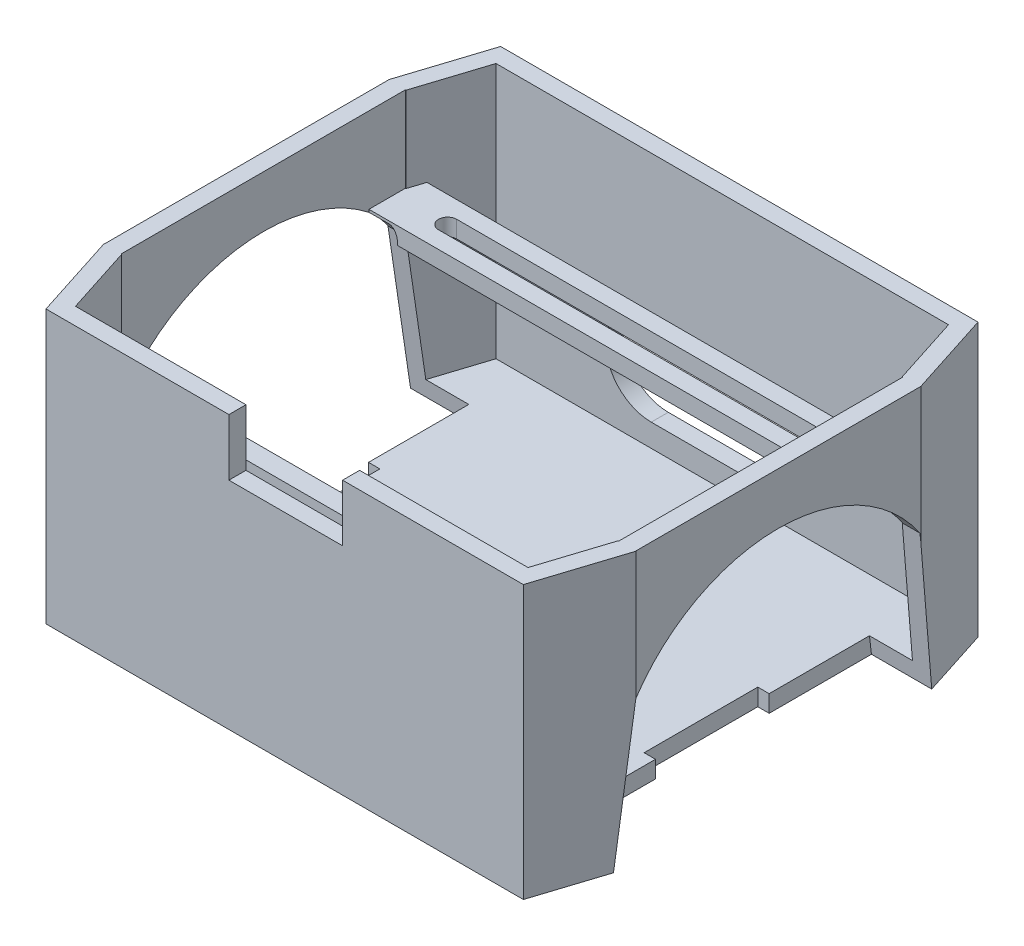
from build123d import *

# Parameters (mm, degrees)
SKETCH1_W            = 90
SKETCH1_H            = 80
BOSS_EXTRUDE1_DEPTH  = 3
SKETCH2_W            = 11.75
SKETCH2_H            = 50
CUT_EXTRUDE1_DEPTH   = 3
SKETCH3_W            = 2
SKETCH3_H            = 15
BOSS_EXTRUDE2_DEPTH  = 3
BOSS_EXTRUDE3_DEPTH  = 3
CUT_EXTRUDE2_DEPTH   = 3
BOSS_EXTRUDE4_DEPTH  = 45
BOSS_EXTRUDE5_DEPTH  = 3
CUT_EXTRUDE3_DEPTH   = 3
CUT_EXTRUDE6_START   = -93.59401
CUT_EXTRUDE6_DEPTH   = 93.644295
MIRROR4_START        = 35.25
MIRROR4_DEPTH        = 11.572147393
SKETCH17_W           = 70.5
SKETCH17_H           = 3
BOSS_EXTRUDE10_DEPTH = 3
SKETCH19_W           = 79.626439034
SKETCH19_H           = 3
BOSS_EXTRUDE11_DEPTH = 10
CUT_EXTRUDE7_DEPTH   = 10
SKETCH22_W           = 87.543724768
SKETCH22_H           = 9.2
BOSS_EXTRUDE12_DEPTH = 3
CUT_EXTRUDE8_DEPTH   = 5
CUT_EXTRUDE9_DEPTH   = 5
FILLET4_R            = 1.5
FILLET6_R            = 1.5
SKETCH26_W           = 20
SKETCH26_H           = 10
CUT_EXTRUDE10_DEPTH  = 5


# Read off the part's stored shape, not the designer's step: Mirror4
with BuildPart() as part:
    # Sketch1 → Boss-Extrude1 (new body)
    with BuildSketch(Plane(origin=(0, 0, 0), x_dir=(1, 0, 0), z_dir=(0, 1, 0))):
        Rectangle(SKETCH1_W, SKETCH1_H)
    extrude(amount=BOSS_EXTRUDE1_DEPTH)

    # Sketch2 → Cut-Extrude1 (cut)
    with BuildSketch(Plane(origin=(0, 3, 0), x_dir=(1, 0, 0), z_dir=(0, 1, 0))):
        with Locations((-39.125, 0)):
            Rectangle(SKETCH2_W, SKETCH2_H)
        with Locations((39.125, 0)):
            Rectangle(SKETCH2_W, SKETCH2_H)
    extrude(amount=-CUT_EXTRUDE1_DEPTH, mode=Mode.SUBTRACT)

    # Sketch3 → Boss-Extrude2 (add)
    with BuildSketch(Plane(origin=(0, 3, 0), x_dir=(1, 0, 0), z_dir=(0, 1, 0))):
        with Locations((-34.25, -17.5)):
            Rectangle(SKETCH3_W, SKETCH3_H)
        with Locations((-34.25, 17.5)):
            Rectangle(SKETCH3_W, SKETCH3_H)
        with Locations((34.25, -17.5)):
            Rectangle(SKETCH3_W, SKETCH3_H)
        with Locations((34.25, 17.5)):
            Rectangle(SKETCH3_W, SKETCH3_H)
    extrude(amount=-BOSS_EXTRUDE2_DEPTH)

    # Sketch4 → Boss-Extrude3 (add)
    with BuildSketch(Plane(origin=(0, 3, 0), x_dir=(1, 0, 0), z_dir=(0, 1, 0))):
        Polygon((-45, 25), (-46.822147393, 25), (-45, 30.668057955), align=None)
        Polygon((45, 25), (46.822147393, 25), (45, 30.668057955), align=None)
        Polygon((-45, -25), (-46.822147393, -25), (-45, -30.668057955), align=None)
        Polygon((45, -25), (46.822147393, -25), (45, -30.668057955), align=None)
    extrude(amount=-BOSS_EXTRUDE3_DEPTH)

    # Sketch5 → Cut-Extrude2 (cut)
    with BuildSketch(Plane(origin=(0, 3, 0), x_dir=(1, 0, 0), z_dir=(0, 1, 0))):
        Polygon((-45, 30.668057955), (-42, 40), (-45, 40), align=None)
        Polygon((45, 30.668057955), (42, 40), (45, 40), align=None)
        Polygon((45, -40), (45, -30.668057955), (42, -40), align=None)
        Polygon((-45, -40), (-45, -30.668057955), (-42, -40), align=None)
    extrude(amount=-CUT_EXTRUDE2_DEPTH, mode=Mode.SUBTRACT)

    # Sketch6 → Boss-Extrude4 (add)
    with BuildSketch(Plane(origin=(0, 3, 0), x_dir=(1, 0, 0), z_dir=(0, 1, 0))):
        Polygon((39.813219517, 37), (-39.813219517, 37), (-43.670937432, 25), (-46.822147393, 25), (-42, 40), (42, 40), (46.771862384, 25.156418928), (46.771862384, 25), (43.670937432, 25), align=None)
        Polygon((43.670937432, -25), (39.813219517, -37), (-39.813219517, -37), (-43.670937432, -25), (-46.822147393, -25), (-42, -40), (42, -40), (46.822147393, -25), align=None)
    extrude(amount=BOSS_EXTRUDE4_DEPTH)

    # Sketch7 → Boss-Extrude5 (add)
    with BuildSketch(Plane(origin=(46.771862384, 0, 0), x_dir=(0, 0, -1), z_dir=(1, 0, 0))):
        with BuildLine():
            Line((-25, 25.5), (-25, 48))
            Line((-25, 48), (25.156418928, 48))
            Line((25.156418928, 48), (25.156418928, 25.5))
            ThreePointArc((25.156418928, 25.5), (0.078209464, 38.896159305), (-25, 25.5))
        make_face()
    boss_extrude5 = extrude(amount=-BOSS_EXTRUDE5_DEPTH)

    # Mirror1: Boss-Extrude5 across plane
    add(boss_extrude5.mirror(Plane.ZY))

    # Sketch10 → Cut-Extrude3 (cut)
    with BuildSketch(Plane(origin=(0, 0, -40), x_dir=(-1, 0, 0), z_dir=(0, 0, -1))):
        with BuildLine():
            Line((-12.5, 23), (12.5, 23))
            ThreePointArc((12.5, 23), (20.5, 15), (12.5, 7))
            Line((12.5, 7), (-12.5, 7))
            ThreePointArc((-12.5, 7), (-20.5, 15), (-12.5, 23))
        make_face()
    extrude(amount=-CUT_EXTRUDE3_DEPTH, mode=Mode.SUBTRACT)

    # Sketch15 → Cut-Extrude6 (cut)
    with BuildSketch(Plane(origin=(46.771862384, 0, 0), x_dir=(0, 0, -1), z_dir=(1, 0, 0)).offset(CUT_EXTRUDE6_START)):
        Polygon((25, 25.731506228), (25, 0), (28, 0), align=None)
    cut_extrude6 = extrude(amount=CUT_EXTRUDE6_DEPTH, mode=Mode.SUBTRACT)

    # Mirror3: Cut-Extrude6 across plane
    add(cut_extrude6.mirror(Plane.ZY), mode=Mode.SUBTRACT)

    # Mirror4 outline → Mirror4 (cut)
    with BuildSketch(Plane.YZ.offset(MIRROR4_START)):
        Polygon((25.731506228, 25), (0, 28), (0, 25), align=None)
    extrude(amount=MIRROR4_DEPTH, mode=Mode.SUBTRACT)

    # Sketch17 → Boss-Extrude10 (add)
    with BuildSketch(Plane(origin=(0, 0, -25), x_dir=(-1, 0, 0), z_dir=(0, 0, -1))):
        with Locations((0, 1.5)):
            Rectangle(SKETCH17_W, SKETCH17_H)
    extrude(amount=BOSS_EXTRUDE10_DEPTH)

    # Sketch19 → Boss-Extrude11 (add)
    with BuildSketch(Plane(origin=(0, 0, 37), x_dir=(-1, 0, 0), z_dir=(0, 0, -1))):
        with Locations((0, 31.5)):
            Rectangle(SKETCH19_W, SKETCH19_H)
    extrude(amount=BOSS_EXTRUDE11_DEPTH)

    # Sketch21 → Cut-Extrude7 (cut)
    with BuildSketch(Plane(origin=(0, 33, 0), x_dir=(1, 0, 0), z_dir=(0, 1, 0))):
        with BuildLine():
            Line((-34.155163783, -30.4), (32.512648359, -30.4))
            ThreePointArc((32.512648359, -30.4), (34.112648359, -32), (32.512648359, -33.6))
            Line((32.512648359, -33.6), (-34.155163783, -33.6))
            ThreePointArc((-34.155163783, -33.6), (-35.755163783, -32), (-34.155163783, -30.4))
        make_face()
    extrude(amount=-CUT_EXTRUDE7_DEPTH, mode=Mode.SUBTRACT)

    # Sketch22 → Boss-Extrude12 (add)
    with BuildSketch(Plane(origin=(0, 33, 0), x_dir=(1, 0, 0), z_dir=(0, 1, 0))):
        with Locations((0, 23.2)):
            Rectangle(SKETCH22_W, SKETCH22_H)
        with BuildLine():
            Line((-34.528137616, 24.8), (35.471862384, 24.8))
            ThreePointArc((35.471862384, 24.8), (37.071862384, 23.2), (35.471862384, 21.6))
            Line((35.471862384, 21.6), (-34.528137616, 21.6))
            ThreePointArc((-34.528137616, 21.6), (-36.128137616, 23.2), (-34.528137616, 24.8))
        make_face(mode=Mode.SUBTRACT)
    extrude(amount=-BOSS_EXTRUDE12_DEPTH)

    # Sketch24 → Cut-Extrude8 (cut)
    with BuildSketch(Plane.ZY.offset(43.771862384)):
        Polygon((-18.6, 32.542028326), (-18.6, 30), (-21.471793131, 30), align=None)
    extrude(amount=-CUT_EXTRUDE8_DEPTH, mode=Mode.SUBTRACT)

    # Sketch25 → Cut-Extrude9 (cut)
    with BuildSketch(Plane(origin=(43.771862384, 0, 0), x_dir=(0, 0, -1), z_dir=(1, 0, 0))):
        Polygon((18.6, 32.542028326), (18.6, 30), (21.471793131, 30), align=None)
    extrude(amount=-CUT_EXTRUDE9_DEPTH, mode=Mode.SUBTRACT)

    # Fillet4
    fillet4_edges = [part.edges().sort_by_distance(p)[0] for p in [
        (38.771862384, 31.271014163, -20.035896565),
    ]]
    fillet(fillet4_edges, radius=FILLET4_R)

    # Fillet6
    fillet6_edges = [part.edges().sort_by_distance(p)[0] for p in [
        (-38.771862384, 31.271014163, -20.035896565),
    ]]
    fillet(fillet6_edges, radius=FILLET6_R)

    # Sketch26 → Cut-Extrude10 (cut)
    with BuildSketch(Plane(origin=(0, 0, 37), x_dir=(-1, 0, 0), z_dir=(0, 0, -1))):
        with Locations((-0.186780483, 43)):
            Rectangle(SKETCH26_W, SKETCH26_H)
    extrude(amount=-CUT_EXTRUDE10_DEPTH, mode=Mode.SUBTRACT)


solid = part.part
